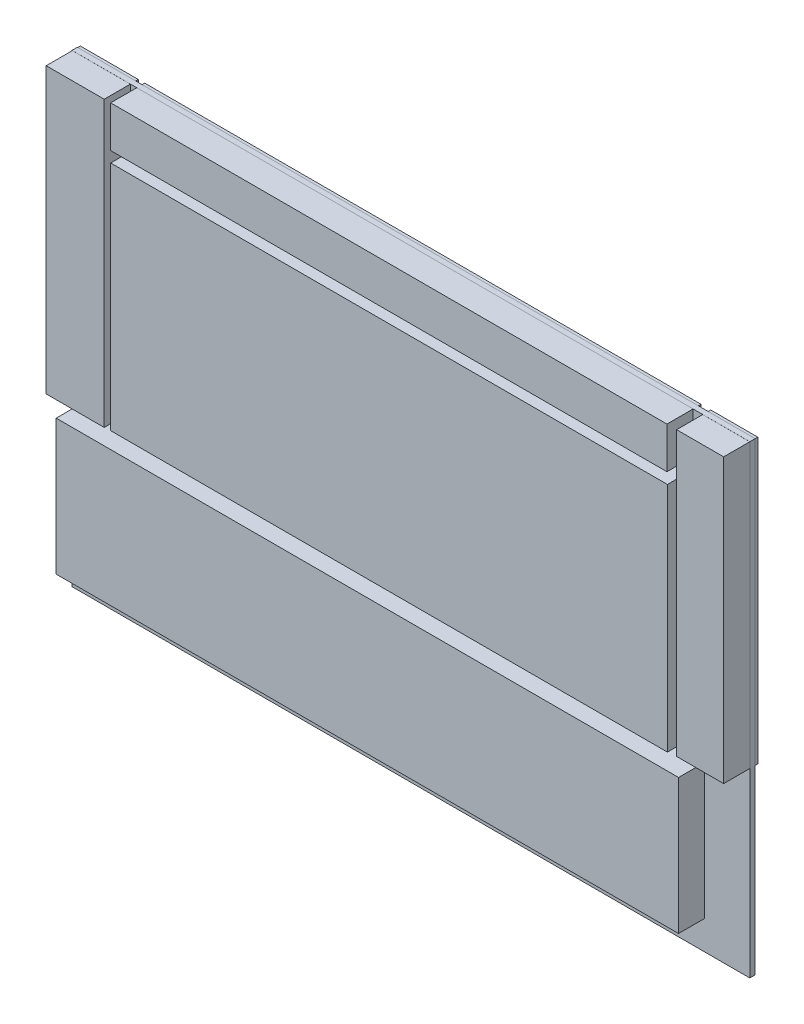
from build123d import *

# Parameters (mm, degrees)
SKETCH4_W                  = 322.834
SKETCH4_H                  = 221.234
BOSS_EXTRUDE4_DEPTH        = 2.54
BOSS_EXTRUDE5_DEPTH        = 12.446
BOSS_EXTRUDE5_DEPTH_BACK   = 3.81
SKETCH5_W                  = 296.442752338
SKETCH5_H                  = 64.375797837
BOSS_EXTRUDE5_2_DEPTH      = 12.446
BOSS_EXTRUDE5_2_DEPTH_BACK = 3.81
SKETCH5_W_2                = 22.413051528
SKETCH5_H_2                = 134.791119828
BOSS_EXTRUDE5_3_DEPTH      = 12.446
BOSS_EXTRUDE5_3_DEPTH_BACK = 3.81
SKETCH5_W_3                = 265.19590248
SKETCH5_H_3                = 110.412913446
BOSS_EXTRUDE5_4_DEPTH      = 12.446
BOSS_EXTRUDE5_4_DEPTH_BACK = 3.81
SKETCH5_W_4                = 264.976066954
SKETCH5_H_4                = 19.685410457
BOSS_EXTRUDE5_5_DEPTH      = 12.446
BOSS_EXTRUDE5_5_DEPTH_BACK = 3.81
SKETCH5_W_5                = 27.624040032
SKETCH5_H_5                = 135.407750905


with BuildPart() as part:
    # Sketch4 → Boss-Extrude4 (new body)
    with BuildSketch(Plane.XY):
        with Locations((36.542483925, -79.149488066)):
            Rectangle(SKETCH4_W, SKETCH4_H)
    extrude(amount=BOSS_EXTRUDE4_DEPTH)


with BuildPart() as body_2:
    # Sketch5 → Boss-Extrude5 (new, two sides: drawn at the far end of the back side and taken through both)
    with BuildSketch(Plane.XY.offset(2.54).offset(-BOSS_EXTRUDE5_DEPTH_BACK)):
        with Locations((28.248384447, -143.75077274)):
            Rectangle(SKETCH5_W, SKETCH5_H)
    extrude(amount=BOSS_EXTRUDE5_DEPTH + BOSS_EXTRUDE5_DEPTH_BACK)


with BuildPart() as body_3:
    # Sketch5 → Boss-Extrude5 2 (new, two sides: drawn at the far end of the back side and taken through both)
    with BuildSketch(Plane.XY.offset(2.54).offset(-BOSS_EXTRUDE5_2_DEPTH_BACK)):
        with Locations((186.752958161, -35.955553972)):
            Rectangle(SKETCH5_W_2, SKETCH5_H_2)
    extrude(amount=BOSS_EXTRUDE5_2_DEPTH + BOSS_EXTRUDE5_2_DEPTH_BACK)


with BuildPart() as body_4:
    # Sketch5 → Boss-Extrude5 3 (new, two sides: drawn at the far end of the back side and taken through both)
    with BuildSketch(Plane.XY.offset(2.54).offset(-BOSS_EXTRUDE5_3_DEPTH_BACK)):
        with Locations((38.571240211, -48.55177825)):
            Rectangle(SKETCH5_W_3, SKETCH5_H_3)
    extrude(amount=BOSS_EXTRUDE5_3_DEPTH + BOSS_EXTRUDE5_3_DEPTH_BACK)


with BuildPart() as body_5:
    # Sketch5 → Boss-Extrude5 4 (new, two sides: drawn at the far end of the back side and taken through both)
    with BuildSketch(Plane.XY.offset(2.54).offset(-BOSS_EXTRUDE5_4_DEPTH_BACK)):
        with Locations((38.461322448, 21.624806705)):
            Rectangle(SKETCH5_W_4, SKETCH5_H_4)
    extrude(amount=BOSS_EXTRUDE5_4_DEPTH + BOSS_EXTRUDE5_4_DEPTH_BACK)


with BuildPart() as body_6:
    # Sketch5 → Boss-Extrude5 5 (new, two sides: drawn at the far end of the back side and taken through both)
    with BuildSketch(Plane.XY.offset(2.54).offset(-BOSS_EXTRUDE5_5_DEPTH_BACK)):
        with Locations((-110.909554488, -36.263869511)):
            Rectangle(SKETCH5_W_5, SKETCH5_H_5)
    extrude(amount=BOSS_EXTRUDE5_5_DEPTH + BOSS_EXTRUDE5_5_DEPTH_BACK)


solid = Compound([part.part, body_2.part, body_3.part, body_4.part, body_5.part, body_6.part])
